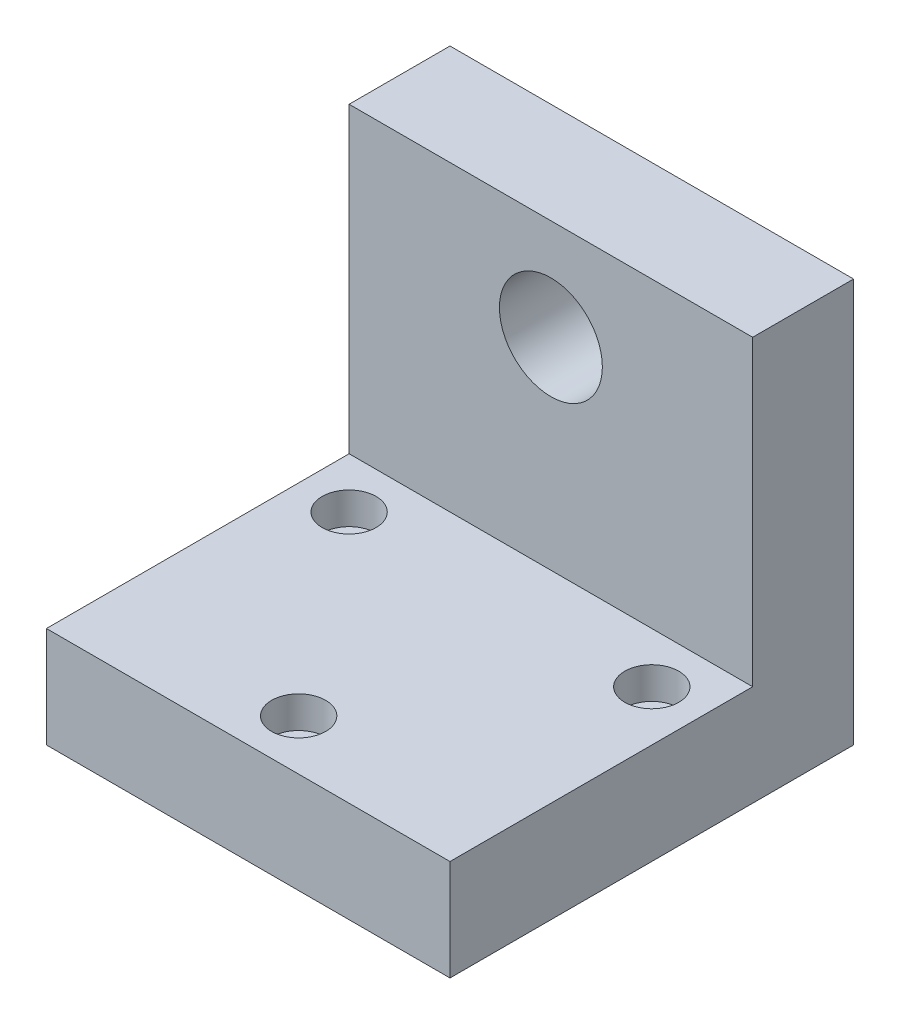
from build123d import *

# Parameters (mm, degrees)
SKETCH1_W               = 25.4
SKETCH1_H               = 25.4
BOSS_EXTRUDE1_DEPTH     = 3.175
SKETCH2_W               = 25.4
SKETCH2_H               = 6.35
BOSS_EXTRUDE2_DEPTH     = 19.05
SKETCH4_R               = 1.127000032
CUT_EXTRUDE2_DEPTH      = 39.75581408
SKETCH9_R               = 1.700000029
CUT_EXTRUDE4_DEPTH      = 2.000000064
CUT_EXTRUDE1_DEPTH      = 41.659838908
CUT_EXTRUDE1_DEPTH_BACK = 41.659838908
SKETCH3_R               = 3.2385


with BuildPart() as part:
    # Sketch1 → Boss-Extrude1 (new, symmetric)
    with BuildSketch(Plane.XY):
        with Locations((12.7, 12.7)):
            Rectangle(SKETCH1_W, SKETCH1_H)
    extrude(amount=BOSS_EXTRUDE1_DEPTH, both=True)

    # Sketch2 → Boss-Extrude2 (add)
    with BuildSketch(Plane.XY.offset(3.175)):
        with Locations((12.7, 3.175)):
            Rectangle(SKETCH2_W, SKETCH2_H)
    extrude(amount=BOSS_EXTRUDE2_DEPTH)

    # Sketch4 → Cut-Extrude2 (cut, through all)
    with BuildSketch(Plane(origin=(0, 6.35, 0), x_dir=(1, 0, 0), z_dir=(0, 1, 0))):
        with Locations((3.175, -6.35)):
            Circle(SKETCH4_R)
        with Locations((22.225, -6.35)):
            Circle(SKETCH4_R)
        with Locations((12.7, -19.05)):
            Circle(SKETCH4_R)
    extrude(amount=-CUT_EXTRUDE2_DEPTH, mode=Mode.SUBTRACT)

    # Sketch9 → Cut-Extrude4 (cut)
    with BuildSketch(Plane(origin=(0, 6.35, 0), x_dir=(1, 0, 0), z_dir=(0, 1, 0))):
        with Locations((3.175, -6.35)):
            Circle(SKETCH9_R)
        with Locations((22.225, -6.35)):
            Circle(SKETCH9_R)
        with Locations((12.7, -19.05)):
            Circle(SKETCH9_R)
    extrude(amount=-CUT_EXTRUDE4_DEPTH, mode=Mode.SUBTRACT)

    # Sketch3 → Cut-Extrude1 (cut, two sides: drawn at the far end of the back side and taken through both)
    with BuildSketch(Plane.XY.offset(3.175).offset(-CUT_EXTRUDE1_DEPTH_BACK)):
        with Locations((12.7, 19.05)):
            Circle(SKETCH3_R)
    extrude(amount=CUT_EXTRUDE1_DEPTH + CUT_EXTRUDE1_DEPTH_BACK, mode=Mode.SUBTRACT)


solid = part.part
